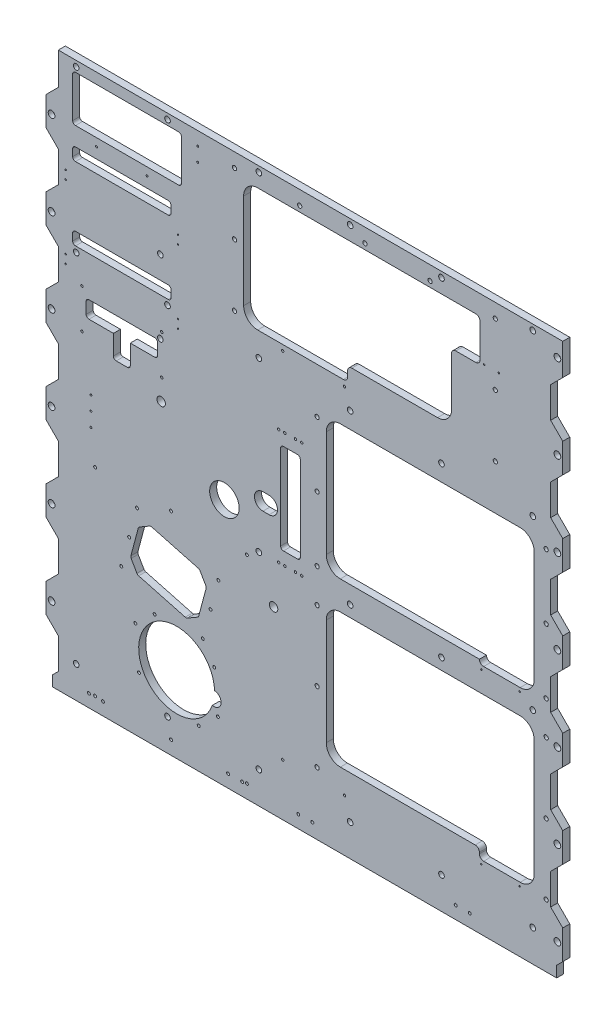
from build123d import *

# Parameters (mm, degrees)
SKETCH_1_W             = 1849
SKETCH_1_H             = 1973
SM_BASE_FLANGE_1_DEPTH = 25
CUT_EXTRUDE_2_DEPTH    = 1353.223169451
SKETCH_8_R             = 12
CUT_EXTRUDE_3_DEPTH    = 16
SKETCH_10_R            = 10
CUT_EXTRUDE_5_DEPTH    = 16
SKETCH_9_R             = 7
SKETCH_9_R_2           = 5.25
CUT_EXTRUDE_4_DEPTH    = 1353.223169451
SKETCH_11_R            = 7.5
SKETCH_11_R_2          = 3.4
SKETCH_11_R_3          = 10
SKETCH_11_R_4          = 2.55
SKETCH_11_R_5          = 4.25
SKETCH_11_R_6          = 15
SKETCH_11_R_7          = 5.15
SKETCH_11_R_8          = 52.5
SKETCH_11_W            = 387
SKETCH_11_H            = 164
SKETCH_11_W_2          = 350
SKETCH_11_H_2          = 45
SKETCH_11_W_3          = 70
SKETCH_11_H_3          = 322
CUT_EXTRUDE_6_DEPTH    = 1353.223169451
FILLET_1_R             = 10
FILLET_2_R             = 50
FILLET_3_R             = 15
FILLET_4_R             = 50
FILLET_5_R             = 15
FILLET_6_R             = 10
CHAMFER_1_SIZE         = 35
FILLET_7_R             = 10
CUT_EXTRUDE_7_DEPTH    = 1353.223169451
SKETCH_13_R            = 7
CUT_EXTRUDE_8_DEPTH    = 1353.223169451
SKETCH_14_R            = 12
CUT_EXTRUDE_9_DEPTH    = 16


# Sheet-metal steps are written as plain solids
with BuildPart() as part:
    # Sketch 1 → 基体-法兰1 (new body)
    with BuildSketch(Plane.XY):
        Rectangle(SKETCH_1_W, SKETCH_1_H)
    extrude(amount=-SM_BASE_FLANGE_1_DEPTH)

    # 草图6 → 切除-拉伸2 (cut, through all)
    with BuildSketch(Plane.XY):
        Polygon((924.5, 874.5), (881.5, 831.5), (881.5, 721.5), (924.5, 678.5), align=None)
        Polygon((924.5, 574.5), (881.5, 531.5), (881.5, 421.5), (924.5, 378.5), align=None)
        Polygon((924.5, 274.5), (881.5, 231.5), (881.5, 121.5), (924.5, 78.5), align=None)
        Polygon((924.5, -25.5), (881.5, -68.5), (881.5, -178.5), (924.5, -221.5), align=None)
        Polygon((924.5, -325.5), (881.5, -368.5), (881.5, -478.5), (924.5, -521.5), align=None)
        Polygon((924.5, -625.5), (881.5, -668.5), (881.5, -778.5), (924.5, -821.5), align=None)
        Polygon((924.5, -925.5), (903, -947), (903, -986.5), (924.5, -986.5), align=None)
    extrude(amount=-CUT_EXTRUDE_2_DEPTH, mode=Mode.SUBTRACT)

    # 草图8 → 切除-拉伸3 (cut)
    with BuildSketch(Plane.XY):
        with Locations((905.5, 926.5)):
            Circle(SKETCH_8_R)
        with Locations((905.5, 626.5)):
            Circle(SKETCH_8_R)
        with Locations((905.5, 326.5)):
            Circle(SKETCH_8_R)
        with Locations((905.5, 26.5)):
            Circle(SKETCH_8_R)
        with Locations((905.5, -273.5)):
            Circle(SKETCH_8_R)
        with Locations((905.5, -573.5)):
            Circle(SKETCH_8_R)
        with Locations((905.5, -873.5)):
            Circle(SKETCH_8_R)
    extrude(amount=-CUT_EXTRUDE_3_DEPTH, mode=Mode.SUBTRACT)

    # 草图10 → 切除-拉伸5 (cut)
    with BuildSketch(Plane.XY):
        with Locations((-807, 966.5)):
            Circle(SKETCH_10_R)
        with Locations((-482, 966.5)):
            Circle(SKETCH_10_R)
        with Locations((-157, 966.5)):
            Circle(SKETCH_10_R)
        with Locations((168, 966.5)):
            Circle(SKETCH_10_R)
        with Locations((493, 966.5)):
            Circle(SKETCH_10_R)
        with Locations((818, 966.5)):
            Circle(SKETCH_10_R)
        with Locations((-807, 394.5)):
            Circle(SKETCH_10_R)
        with Locations((493, 394.5)):
            Circle(SKETCH_10_R)
        with Locations((818, 394.5)):
            Circle(SKETCH_10_R)
        with Locations((168, 394.5)):
            Circle(SKETCH_10_R)
        with Locations((-157, 394.5)):
            Circle(SKETCH_10_R)
        with Locations((-482, 394.5)):
            Circle(SKETCH_10_R)
        with Locations((818, -203.5)):
            Circle(SKETCH_10_R)
        with Locations((493, -203.5)):
            Circle(SKETCH_10_R)
        with Locations((-157, -203.5)):
            Circle(SKETCH_10_R)
        with Locations((168, -203.5)):
            Circle(SKETCH_10_R)
        with Locations((818, -873.5)):
            Circle(SKETCH_10_R)
        with Locations((-482, -873.5)):
            Circle(SKETCH_10_R)
        with Locations((-807, -873.5)):
            Circle(SKETCH_10_R)
        with Locations((-157, -873.5)):
            Circle(SKETCH_10_R)
        with Locations((168, -873.5)):
            Circle(SKETCH_10_R)
        with Locations((493, -873.5)):
            Circle(SKETCH_10_R)
    extrude(amount=-CUT_EXTRUDE_5_DEPTH, mode=Mode.SUBTRACT)

    # 草图9 → 切除-拉伸4 (cut, through all)
    with BuildSketch(Plane.XY):
        with Locations((905.5, 926.5)):
            Circle(SKETCH_9_R)
        with Locations((905.5, 626.5)):
            Circle(SKETCH_9_R)
        with Locations((905.5, 326.5)):
            Circle(SKETCH_9_R)
        with Locations((905.5, 26.5)):
            Circle(SKETCH_9_R)
        with Locations((905.5, -273.5)):
            Circle(SKETCH_9_R)
        with Locations((905.5, -573.5)):
            Circle(SKETCH_9_R)
        with Locations((905.5, -873.5)):
            Circle(SKETCH_9_R)
        with Locations((818, 966.5)):
            Circle(SKETCH_9_R_2)
        with Locations((493, 966.5)):
            Circle(SKETCH_9_R_2)
        with Locations((168, 966.5)):
            Circle(SKETCH_9_R_2)
        with Locations((-157, 966.5)):
            Circle(SKETCH_9_R_2)
        with Locations((-482, 966.5)):
            Circle(SKETCH_9_R_2)
        with Locations((-807, 966.5)):
            Circle(SKETCH_9_R_2)
        with Locations((-807, 394.5)):
            Circle(SKETCH_9_R_2)
        with Locations((-482, 394.5)):
            Circle(SKETCH_9_R_2)
        with Locations((-157, 394.5)):
            Circle(SKETCH_9_R_2)
        with Locations((168, 394.5)):
            Circle(SKETCH_9_R_2)
        with Locations((493, 394.5)):
            Circle(SKETCH_9_R_2)
        with Locations((818, 394.5)):
            Circle(SKETCH_9_R_2)
        with Locations((818, -203.5)):
            Circle(SKETCH_9_R_2)
        with Locations((493, -203.5)):
            Circle(SKETCH_9_R_2)
        with Locations((168, -203.5)):
            Circle(SKETCH_9_R_2)
        with Locations((-157, -203.5)):
            Circle(SKETCH_9_R_2)
        with Locations((-807, -873.5)):
            Circle(SKETCH_9_R_2)
        with Locations((-482, -873.5)):
            Circle(SKETCH_9_R_2)
        with Locations((-157, -873.5)):
            Circle(SKETCH_9_R_2)
        with Locations((168, -873.5)):
            Circle(SKETCH_9_R_2)
        with Locations((493, -873.5)):
            Circle(SKETCH_9_R_2)
        with Locations((818, -873.5)):
            Circle(SKETCH_9_R_2)
    extrude(amount=-CUT_EXTRUDE_4_DEPTH, mode=Mode.SUBTRACT)

    # 草图11 → 切除-拉伸6 (cut, through all)
    with BuildSketch(Plane.XY):
        with Locations((-243.5, 936.5)):
            Circle(SKETCH_11_R)
        with Locations((-243.5, 716.5)):
            Circle(SKETCH_11_R)
        with Locations((-243.5, 496.5)):
            Circle(SKETCH_11_R)
        with Locations((-11.5, 936.5)):
            Circle(SKETCH_11_R)
        with Locations((220.5, 936.5)):
            Circle(SKETCH_11_R)
        with Locations((452.5, 936.5)):
            Circle(SKETCH_11_R)
        with Locations((684.5, 936.5)):
            Circle(SKETCH_11_R)
        with Locations((684.5, 716.5)):
            Circle(SKETCH_11_R)
        with Locations((684.5, 496.5)):
            Circle(SKETCH_11_R)
        with Locations((-374.5, 938.5)):
            Circle(SKETCH_11_R_2)
        with Locations((-374.5, 888.5)):
            Circle(SKETCH_11_R_2)
        with Locations((-734.5, 756.5)):
            Circle(SKETCH_11_R_2)
        with Locations(Location((-554.5, 756.5, 0), (0, 0, 180))):
            Circle(SKETCH_11_R_2)
        with Locations((-507.5, 538.5)):
            Circle(SKETCH_11_R_3)
        with Locations((-507.5, 278.5)):
            Circle(SKETCH_11_R_3)
        with Locations((-844.5, 630.5)):
            Circle(SKETCH_11_R_4)
        with Locations((-844.5, 600.5)):
            Circle(SKETCH_11_R_4)
        with Locations((-844.5, 370.5)):
            Circle(SKETCH_11_R_4)
        with Locations((-844.5, 340.5)):
            Circle(SKETCH_11_R_4)
        with Locations(Location((-444.5, 340.5, 0), (0, 0, 180))):
            Circle(SKETCH_11_R_4)
        with Locations(Location((-444.5, 370.5, 0), (0, 0, 180))):
            Circle(SKETCH_11_R_4)
        with Locations(Location((-444.5, 600.5, 0), (0, 0, 180))):
            Circle(SKETCH_11_R_4)
        with Locations(Location((-444.5, 630.5, 0), (0, 0, 180))):
            Circle(SKETCH_11_R_4)
        with Locations((-786.5, 301.5)):
            Circle(SKETCH_11_R_5)
        with Locations((-786.5, 161.5)):
            Circle(SKETCH_11_R_5)
        with Locations(Location((-502.5, 161.5, 0), (0, 0, 180))):
            Circle(SKETCH_11_R_5)
        with Locations(Location((-502.5, 301.5, 0), (0, 0, 180))):
            Circle(SKETCH_11_R_5)
        with Locations((-504.5, 86.5)):
            Circle(SKETCH_11_R_6)
        with Locations((-754.5, -18.5)):
            Circle(SKETCH_11_R_2)
        with Locations((-754.5, -68.5)):
            Circle(SKETCH_11_R_2)
        with Locations((-754.5, -118.5)):
            Circle(SKETCH_11_R_2)
        with Locations((645, 775)):
            Circle(SKETCH_11_R_4)
        with Locations((697, 775)):
            Circle(SKETCH_11_R_4)
        with Locations((50.5, 316.5)):
            Circle(SKETCH_11_R)
        with Locations((865.5, 316.5)):
            Circle(SKETCH_11_R)
        with Locations((865.5, 86.5)):
            Circle(SKETCH_11_R)
        with Locations((865.5, -263.5)):
            Circle(SKETCH_11_R)
        with Locations((50.5, 86.5)):
            Circle(SKETCH_11_R)
        with Locations((50.5, -263.5)):
            Circle(SKETCH_11_R)
        with Locations((50.5, -143.5)):
            Circle(SKETCH_11_R)
        with Locations((50.5, -763.5)):
            Circle(SKETCH_11_R)
        with Locations((50.5, -513.5)):
            Circle(SKETCH_11_R)
        with Locations((865.5, -143.5)):
            Circle(SKETCH_11_R)
        with Locations((865.5, -763.5)):
            Circle(SKETCH_11_R)
        with Locations((865.5, -513.5)):
            Circle(SKETCH_11_R)
        with Locations((-72, 458.5)):
            Circle(SKETCH_11_R_5)
        with Locations((148, 458.5)):
            Circle(SKETCH_11_R_5)
        with Locations((635, -170)):
            Circle(SKETCH_11_R_4)
        with Locations((771, -170)):
            Circle(SKETCH_11_R_4)
        with Locations((635, -770)):
            Circle(SKETCH_11_R_4)
        with Locations((771, -770)):
            Circle(SKETCH_11_R_4)
        with Locations((593.5, -941.5)):
            Circle(SKETCH_11_R_7)
        with Locations((543.5, -941.5)):
            Circle(SKETCH_11_R_7)
        with Locations((-16.5, -941.5)):
            Circle(SKETCH_11_R_7)
        with Locations((33.5, -941.5)):
            Circle(SKETCH_11_R_7)
        with Locations((-266.5, -941.5)):
            Circle(SKETCH_11_R_7)
        with Locations((-216.5, -941.5)):
            Circle(SKETCH_11_R_7)
        with Locations((-761.5, -941.5)):
            Circle(SKETCH_11_R_7)
        with Locations((-711.5, -941.5)):
            Circle(SKETCH_11_R_7)
        with Locations((148, -801.5)):
            Circle(SKETCH_11_R_5)
        with Locations((-72, -801.5)):
            Circle(SKETCH_11_R_5)
        with Locations((-86.5, 209.5)):
            Circle(SKETCH_11_R_5)
        with Locations((-64.5, 209.5)):
            Circle(SKETCH_11_R_5)
        with Locations((-26.5, 209.5)):
            Circle(SKETCH_11_R_5)
        with Locations((-4.5, 209.5)):
            Circle(SKETCH_11_R_5)
        with Locations((-86.5, -200.5)):
            Circle(SKETCH_11_R_5)
        with Locations((-64.5, -200.5)):
            Circle(SKETCH_11_R_5)
        with Locations((-4.5, -200.5)):
            Circle(SKETCH_11_R_5)
        with Locations((-26.5, -200.5)):
            Circle(SKETCH_11_R_5)
        with Locations((-104.5, -346.5)):
            Circle(SKETCH_11_R_6)
        with Locations((-739.5, -938.5)):
            Circle(SKETCH_11_R_7)
        with Locations((-469.5, -938.5)):
            Circle(SKETCH_11_R_7)
        with Locations((-199.5, -938.5)):
            Circle(SKETCH_11_R_7)
        with Locations((-739.5, -233.5)):
            Circle(SKETCH_11_R_7)
        with Locations((-469.5, -233.5)):
            Circle(SKETCH_11_R_7)
        with Locations((-199.5, -233.5)):
            Circle(SKETCH_11_R_7)
        with Locations((-279.5, -103.5)):
            Circle(SKETCH_11_R_8)
        with Locations((-527.928793543, -581.192878713)):
            Circle(SKETCH_11_R_7)
        with Locations((-596.283560853, -643.111177995)):
            Circle(SKETCH_11_R_7)
        with Locations((-583.57488824, -788.866931365)):
            Circle(SKETCH_11_R_7)
        with Locations(Location((-371.071206457, -845.807121287, 0), (0, 0, 180))):
            Circle(SKETCH_11_R_7)
        with Locations(Location((-315.42511176, -638.133068635, 0), (0, 0, 180))):
            Circle(SKETCH_11_R_7)
        with Locations((-590.669267315, -284.857050722)):
            Circle(SKETCH_11_R_7)
        with Locations((-300.891519428, -362.502764253)):
            Circle(SKETCH_11_R_7)
        with Locations(Location((-356.537614125, -570.176816905, 0), (0, 0, 180))):
            Circle(SKETCH_11_R_7)
        with Locations(Location((-646.315362012, -492.531103374, 0), (0, 0, 180))):
            Circle(SKETCH_11_R_7)
        with Locations((-328.714566777, -466.339790579)):
            Circle(SKETCH_11_R_7)
        with Locations((-618.492314664, -388.694077048)):
            Circle(SKETCH_11_R_7)
        with Locations((-302.716439147, -783.888822005)):
            Circle(SKETCH_11_R_7)
        Polygon((-517.5, 271.5), (-771.5, 271.5), (-771.5, 211.5), (-674.5, 211.5), (-674.5, 131.5), (-614.5, 131.5), (-614.5, 211.5), (-517.5, 211.5), align=None)
        with Locations((-626, 866.5)):
            Rectangle(SKETCH_11_W, SKETCH_11_H)
        with Locations((-644.5, 696)):
            Rectangle(SKETCH_11_W_2, SKETCH_11_H_2)
        with Locations((-644.5, 436)):
            Rectangle(SKETCH_11_W_2, SKETCH_11_H_2)
        Polygon((-211, 916.5), (630, 916.5), (630, 766.5), (529, 766.5), (529, 528.5), (159, 528.5), (159, 478.5), (-211, 478.5), align=None)
        Polygon((83, -141.5), (628, -141.5), (628, -156.5), (823, -156.5), (823, 336.5), (83, 336.5), align=None)
        Polygon((83, -243.5), (823, -243.5), (823, -756.5), (628, -756.5), (628, -721.5), (83, -721.5), align=None)
        with Locations((-44.5, 4.5)):
            Rectangle(SKETCH_11_W_3, SKETCH_11_H_3)
        with BuildLine():
            Line((-142.5, -10.5), (-120.5, -10.5))
            ThreePointArc((-120.5, -10.5), (-90.5, -40.5), (-120.5, -70.5))
            Line((-120.5, -70.5), (-142.5, -70.5))
            ThreePointArc((-142.5, -70.5), (-172.5, -40.5), (-142.5, -10.5))
        make_face()
        Polygon((-334.398627506, -371.64189486), (-575.880084079, -306.937133584), (-622.467512197, -480.803782316), (-380.986055625, -545.508543592), align=None)
        with BuildLine():
            ThreePointArc((-314.554328752, -709.67040324), (-582.83792598, -692.38134722), (-322.342450494, -758.842668687))
            ThreePointArc((-322.342450494, -758.842668687), (-291.469865505, -738.529514406), (-314.554328752, -709.67040324))
        make_face()
    extrude(amount=-CUT_EXTRUDE_6_DEPTH, mode=Mode.SUBTRACT)

    # 圆角1
    fillet_1_edges = [part.edges().sort_by_distance(p)[0] for p in [
        (-819.5, 784.5, -12.5),
        (-819.5, 948.5, -12.5),
        (-432.5, 948.5, -12.5),
        (-432.5, 784.5, -12.5),
        (-771.5, 211.5, -12.5),
        (-771.5, 271.5, -12.5),
        (-517.5, 271.5, -12.5),
        (-517.5, 211.5, -12.5),
        (-614.5, 131.5, -12.5),
        (-674.5, 131.5, -12.5),
        (-819.5, 413.5, -12.5),
        (-819.5, 458.5, -12.5),
        (-469.5, 458.5, -12.5),
        (-469.5, 413.5, -12.5),
        (-819.5, 673.5, -12.5),
        (-819.5, 718.5, -12.5),
        (-469.5, 718.5, -12.5),
        (-469.5, 673.5, -12.5),
    ]]
    fillet(fillet_1_edges, radius=FILLET_1_R)

    # 圆角2
    fillet_2_edges = [part.edges().sort_by_distance(p)[0] for p in [
        (-211, 478.5, -12.5),
        (-211, 916.5, -12.5),
        (529, 528.5, -12.5),
    ]]
    fillet(fillet_2_edges, radius=FILLET_2_R)

    # 圆角3
    fillet_3_edges = [part.edges().sort_by_distance(p)[0] for p in [
        (630, 916.5, -12.5),
        (630, 766.5, -12.5),
        (529, 766.5, -12.5),
        (159, 528.5, -12.5),
        (159, 478.5, -12.5),
    ]]
    fillet(fillet_3_edges, radius=FILLET_3_R)

    # 圆角4
    fillet_4_edges = [part.edges().sort_by_distance(p)[0] for p in [
        (83, -141.5, -12.5),
        (83, 336.5, -12.5),
        (823, 336.5, -12.5),
        (823, -156.5, -12.5),
        (83, -721.5, -12.5),
        (83, -243.5, -12.5),
        (823, -243.5, -12.5),
        (823, -756.5, -12.5),
    ]]
    fillet(fillet_4_edges, radius=FILLET_4_R)

    # 圆角5
    fillet_5_edges = [part.edges().sort_by_distance(p)[0] for p in [
        (628, -156.5, -12.5),
        (628, -756.5, -12.5),
        (628, -721.5, -12.5),
    ]]
    fillet(fillet_5_edges, radius=FILLET_5_R - 0.0001)  # a hair under: the kernel refuses the full size

    # 圆角6
    fillet_6_edges = [part.edges().sort_by_distance(p)[0] for p in [
        (-79.5, -156.5, -12.5),
        (-79.5, 165.5, -12.5),
        (-9.5, 165.5, -12.5),
        (-9.5, -156.5, -12.5),
    ]]
    fillet(fillet_6_edges, radius=FILLET_6_R)

    # 倒角1
    chamfer_1_edges = [part.edges().sort_by_distance(p)[0] for p in [
        (-622.467512197, -480.803782316, -12.5),
        (-575.880084079, -306.937133584, -12.5),
        (-334.398627506, -371.64189486, -12.5),
        (-380.986055625, -545.508543592, -12.5),
    ]]
    chamfer(chamfer_1_edges, length=CHAMFER_1_SIZE)

    # 圆角7
    fillet_7_edges = [part.edges().sort_by_distance(p)[0] for p in [
        (-613.408845618, -446.996378396, -12.5),
        (-584.938750657, -340.744537504, -12.5),
        (-368.206031426, -362.583228281, -12.5),
        (-542.072680158, -315.995800163, -12.5),
        (-414.793459545, -536.449877013, -12.5),
        (-588.660108277, -489.862448895, -12.5),
        (-343.457294085, -405.44929878, -12.5),
        (-371.927389046, -511.701139672, -12.5),
    ]]
    fillet(fillet_7_edges, radius=FILLET_7_R)

    # 草图12 → 切除-拉伸7 (cut, through all)
    with BuildSketch(Plane.XY):
        Polygon((-924.5, 986.5), (-870.5, 986.5), (-870.5, 871.5), (-913.5, 828.5), (-913.5, 724.5), (-870.5, 681.5), (-870.5, 571.5), (-913.5, 528.5), (-913.5, 424.5), (-870.5, 381.5), (-870.5, 271.5), (-913.5, 228.5), (-913.5, 124.5), (-870.5, 81.5), (-870.5, -28.5), (-913.5, -71.5), (-913.5, -175.5), (-870.5, -218.5), (-870.5, -328.5), (-913.5, -371.5), (-913.5, -475.5), (-870.5, -518.5), (-870.5, -628.5), (-913.5, -671.5), (-913.5, -775.5), (-870.5, -818.5), (-870.5, -928.5), (-892, -950), (-892, -986.5), (-924.5, -986.5), align=None)
    extrude(amount=-CUT_EXTRUDE_7_DEPTH, mode=Mode.SUBTRACT)

    # 草图13 → 切除-拉伸8 (cut, through all)
    with BuildSketch(Plane.XY):
        with Locations((-894.5, 776.5)):
            Circle(SKETCH_13_R)
        with Locations((-894.5, 476.5)):
            Circle(SKETCH_13_R)
        with Locations((-894.5, 176.5)):
            Circle(SKETCH_13_R)
        with Locations((-894.5, -123.5)):
            Circle(SKETCH_13_R)
        with Locations((-894.5, -423.5)):
            Circle(SKETCH_13_R)
        with Locations((-894.5, -723.5)):
            Circle(SKETCH_13_R)
    extrude(amount=-CUT_EXTRUDE_8_DEPTH, mode=Mode.SUBTRACT)

    # 草图14 → 切除-拉伸9 (cut)
    with BuildSketch(Plane.XY):
        with Locations((-894.5, 776.5)):
            Circle(SKETCH_14_R)
        with Locations((-894.5, 476.5)):
            Circle(SKETCH_14_R)
        with Locations((-894.5, 176.5)):
            Circle(SKETCH_14_R)
        with Locations((-894.5, -123.5)):
            Circle(SKETCH_14_R)
        with Locations((-894.5, -423.5)):
            Circle(SKETCH_14_R)
        with Locations((-894.5, -723.5)):
            Circle(SKETCH_14_R)
    extrude(amount=-CUT_EXTRUDE_9_DEPTH, mode=Mode.SUBTRACT)


solid = part.part
